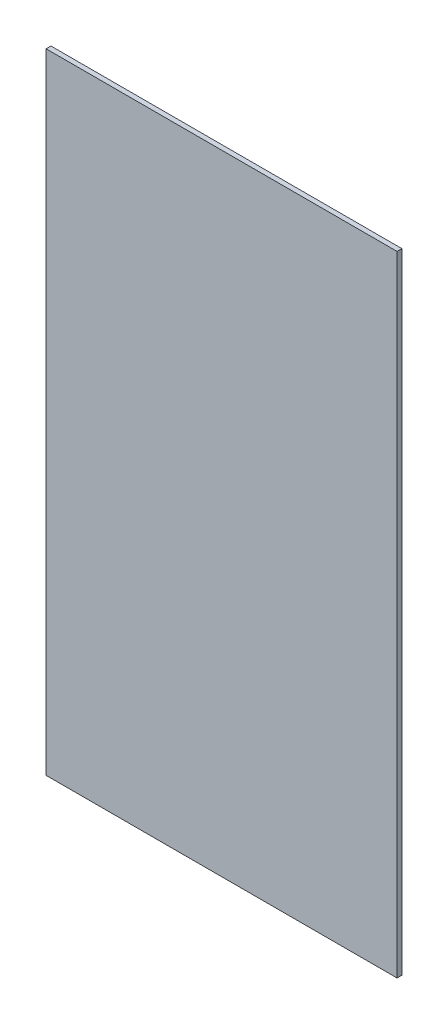
from build123d import *

# Parameters (mm, degrees)
SKETCH1_W           = 9.2075
SKETCH1_H           = 16.51
BOSS_EXTRUDE1_DEPTH = 0.127
WRAP1_START         = -0.0254
WRAP1_DEPTH         = 0.0254


# Read off the part's stored shape, not the designer's step: Wrap1
with BuildPart() as part:
    # Sketch1 → Boss-Extrude1 (new body)
    with BuildSketch(Plane.XY):
        with Locations((-14.669644351, 41.878696913)):
            Rectangle(SKETCH1_W, SKETCH1_H)
    extrude(amount=BOSS_EXTRUDE1_DEPTH)

    # Wrap1 outline → Wrap1 (cut)
    # profile 1 of 4: a face of its own
    with BuildSketch(Plane(origin=(0, 0, 0), x_dir=(-1, 0, 0), z_dir=(0, 0, -1)).offset(WRAP1_START)):
        with BuildLine():
            add(Edge.make_bspline(
                [(12.754195013, 35.369837928), (12.7302514, 35.363485984), (12.684730689, 35.351409901), (12.617465783, 35.344197722), (12.555782538, 35.346965505), (12.499458703, 35.359902044), (12.44943973, 35.384788998), (12.405542275, 35.419870428), (12.367751604, 35.465127753), (12.337830196, 35.518652718), (12.316076601, 35.575477835), (12.303665057, 35.631953818), (12.303965451, 35.686435762), (12.317272149, 35.737607038), (12.341374713, 35.78598946), (12.378118313, 35.830483531), (12.425460462, 35.872778478), (12.463142079, 35.89613621), (12.482992555, 35.90844094)],
                knots=[0, 0, 0, 0, 0.077726432, 0.147770616, 0.211548784, 0.270927228, 0.327895714, 0.385505761, 0.446243759, 0.511912564, 0.577218406, 0.636811441, 0.692545749, 0.746612378, 0.801503143, 0.860977879, 0.926763881, 1, 1, 1, 1], degree=3))
            Line((12.754195013, 35.369837928), (15.230501566, 36.625099771))
            Line((15.230501566, 36.625099771), (16.18224477, 35.63470388))
            add(Edge.make_bspline(
                [(16.618830035, 36.05608153), (16.632346442, 36.036387077), (16.657970773, 35.99905044), (16.684879163, 35.939908415), (16.701202291, 35.88261282), (16.704360316, 35.826437061), (16.696209976, 35.771841191), (16.675014413, 35.719604082), (16.642356284, 35.669326668), (16.599558818, 35.622991267), (16.551509997, 35.5826488), (16.500267548, 35.553138521), (16.448421639, 35.535072681), (16.395218592, 35.530880946), (16.341459507, 35.53783476), (16.287609709, 35.558503293), (16.233513601, 35.59108586), (16.200005781, 35.619593332), (16.18224477, 35.63470388)],
                knots=[0, 0, 0, 0, 0.075168859, 0.14250471, 0.203878623, 0.261899768, 0.318493707, 0.37648046, 0.438167773, 0.506513204, 0.574627985, 0.635161891, 0.692009835, 0.746141543, 0.801887068, 0.861502259, 0.926588482, 1, 1, 1, 1], degree=3))
            Line((16.618830035, 36.05608153), (15.106939699, 37.625634072))
            Line((15.106939699, 37.625634072), (16.396418674, 37.625634072))
            add(Edge.make_bspline(
                [(16.396418674, 38.228869445), (16.419739871, 38.226285995), (16.463954003, 38.22138809), (16.52570904, 38.205398766), (16.578162156, 38.180362601), (16.621817506, 38.147785143), (16.65561524, 38.106569203), (16.680074206, 38.057673788), (16.695079698, 38.001222704), (16.699870998, 37.939805513), (16.697679332, 37.878150965), (16.684326243, 37.820397698), (16.660842522, 37.769413814), (16.626638141, 37.725931096), (16.583448306, 37.688905899), (16.529416497, 37.660921883), (16.466608834, 37.638250255), (16.420678658, 37.629994632), (16.396418674, 37.625634072)],
                knots=[0, 0, 0, 0, 0.073642632, 0.139617403, 0.199251584, 0.255106185, 0.309293346, 0.365065168, 0.425571036, 0.491512451, 0.557929264, 0.618587659, 0.676454286, 0.732713138, 0.791064393, 0.853692913, 0.922721664, 1, 1, 1, 1], degree=3))
            Line((16.396418674, 38.228869445), (12.615425531, 38.228869445))
            add(Edge.make_bspline(
                [(12.615425531, 37.625634072), (12.59181657, 37.630050549), (12.546769776, 37.638477356), (12.485015211, 37.660685192), (12.43202381, 37.68932657), (12.388991975, 37.725714847), (12.355354595, 37.769481471), (12.332866668, 37.820634371), (12.318483946, 37.878048835), (12.315787423, 37.939783609), (12.320006756, 38.001130938), (12.334136705, 38.057797338), (12.358857207, 38.106352751), (12.391843084, 38.147761354), (12.435047012, 38.180537391), (12.487243395, 38.205244445), (12.548500877, 38.221425467), (12.592309604, 38.226298278), (12.615425531, 38.228869445)],
                knots=[0, 0, 0, 0, 0.075839881, 0.144705368, 0.206585145, 0.265329705, 0.321560784, 0.379537358, 0.440761422, 0.507662578, 0.573991332, 0.634732734, 0.690880475, 0.745010219, 0.800711387, 0.860747521, 0.926522625, 1, 1, 1, 1], degree=3))
            Line((12.615425531, 37.625634072), (14.268619952, 37.625634072))
            Line((14.268619952, 37.625634072), (14.794549952, 37.080694554))
            Line((14.794549952, 37.080694554), (12.482992555, 35.90844094))
        make_face()
    # profile 2 of 4: a face of its own
    with BuildSketch(Plane(origin=(0, 0, 0), x_dir=(-1, 0, 0), z_dir=(0, 0, -1)).offset(WRAP1_START)):
        with BuildLine():
            add(Edge.make_bspline(
                [(13.047575242, 39.153999324), (13.020565506, 39.170397438), (12.966704064, 39.203097725), (12.889276071, 39.257267095), (12.814727047, 39.315536302), (12.744302072, 39.37910097), (12.675801125, 39.445922965), (12.610595397, 39.517236285), (12.549482157, 39.593843689), (12.490249391, 39.672716183), (12.437718426, 39.755560493), (12.394528764, 39.841630583), (12.359777926, 39.929487791), (12.335032031, 40.019797717), (12.319870897, 40.112410175), (12.31352497, 40.207026903), (12.316396513, 40.303891545), (12.326032667, 40.368353467), (12.330916411, 40.401023709)],
                knots=[0, 0, 0, 0, 0.061850963, 0.123340048, 0.184890287, 0.246981332, 0.308975903, 0.372205026, 0.436014336, 0.500775998, 0.565257145, 0.627766796, 0.689048332, 0.749944952, 0.810723512, 0.872479012, 0.935370505, 1, 1, 1, 1], degree=3))
            add(Edge.make_bspline(
                [(15.440239915, 38.953132083), (15.390736365, 38.937681139), (15.291933808, 38.906843093), (15.141644573, 38.868807028), (14.989739533, 38.838977629), (14.836569089, 38.817150582), (14.682071565, 38.80139499), (14.525952955, 38.794773648), (14.368418204, 38.795333989), (14.210256211, 38.803669263), (14.053250399, 38.819052747), (13.899115301, 38.84338307), (13.748403962, 38.874865467), (13.601279506, 38.915053152), (13.457363794, 38.962431738), (13.316885067, 39.017812179), (13.17967544, 39.080728277), (13.091636172, 39.129560371), (13.047575242, 39.153999324)],
                knots=[0, 0, 0, 0, 0.062950861, 0.125641615, 0.188101714, 0.250802955, 0.313418143, 0.376562472, 0.440413566, 0.504607187, 0.568778782, 0.631848088, 0.693959276, 0.755605023, 0.816909022, 0.877812703, 0.938849039, 1, 1, 1, 1], degree=3))
            add(Edge.make_bspline(
                [(16.699937312, 40.319916432), (16.698715623, 40.276974445), (16.696320809, 40.192797527), (16.677610239, 40.069496857), (16.646475993, 39.952472543), (16.603397029, 39.840910653), (16.546155734, 39.736261976), (16.478243728, 39.636568797), (16.397162788, 39.543458512), (16.30353829, 39.458706035), (16.204179087, 39.378421994), (16.101175663, 39.303167786), (15.99677858, 39.232015443), (15.890081966, 39.165938588), (15.781025073, 39.104945851), (15.669314181, 39.049560246), (15.556227713, 38.997573399), (15.478853218, 38.967926967), (15.440239915, 38.953132083)],
                knots=[0, 0, 0, 0, 0.064865228, 0.127151896, 0.18792138, 0.247542801, 0.30737398, 0.367746614, 0.429503662, 0.493416613, 0.558312454, 0.622464006, 0.686108662, 0.74916729, 0.812031791, 0.87483145, 0.937535344, 1, 1, 1, 1], degree=3))
            add(Edge.make_bspline(
                [(16.554831324, 40.847747383), (16.577106188, 40.805811266), (16.62103266, 40.723112411), (16.666327282, 40.591198468), (16.695006674, 40.456554383), (16.698293465, 40.365470759), (16.699937312, 40.319916432)],
                knots=[0, 0, 0, 0, 0.257009808, 0.506828434, 0.753346452, 1, 1, 1, 1], degree=3))
            add(Edge.make_bspline(
                [(12.330916411, 40.401023709), (12.341658838, 40.453680213), (12.362823153, 40.557422016), (12.412817707, 40.706106683), (12.476374603, 40.845331452), (12.554156659, 40.974796833), (12.646186394, 41.094897018), (12.752396269, 41.205193981), (12.872502018, 41.306261554), (13.006235209, 41.395407843), (13.147982814, 41.47650703), (13.29497072, 41.548650844), (13.445846867, 41.611712386), (13.600589967, 41.665454463), (13.759374118, 41.710765472), (13.922163513, 41.746070379), (14.088915317, 41.772023594), (14.258578003, 41.788948689), (14.429886846, 41.797088379), (14.601023806, 41.796795808), (14.771017061, 41.786143501), (14.939901664, 41.768260492), (15.107364574, 41.74004135), (15.273806488, 41.703224529), (15.439182558, 41.657499186), (15.602119891, 41.603735104), (15.759207756, 41.541247608), (15.906688134, 41.468862266), (16.043354319, 41.388062532), (16.168333209, 41.29748971), (16.282087228, 41.198318153), (16.385513343, 41.090876698), (16.477427957, 40.974167414), (16.529022883, 40.889899346), (16.554831324, 40.847747383)],
                knots=[0, 0, 0, 0, 0.031147051, 0.061364714, 0.090747353, 0.119762221, 0.148773727, 0.17831962, 0.208404877, 0.239631333, 0.271404761, 0.303072678, 0.334538531, 0.366192464, 0.398030774, 0.430254239, 0.462742101, 0.495862476, 0.52910046, 0.562177985, 0.595068726, 0.627849083, 0.660637451, 0.69351176, 0.726680813, 0.760113967, 0.792986679, 0.824654596, 0.855308419, 0.884959528, 0.914047755, 0.942727571, 0.9713516, 1, 1, 1, 1], degree=3))
        make_face()
        with BuildLine():
            add(Edge.make_bspline(
                [(14.946626096, 41.153800624), (14.908460653, 41.159999561), (14.828434558, 41.172997621), (14.70179711, 41.183104008), (14.563709638, 41.186321639), (14.416344734, 41.184755833), (14.26355893, 41.175680605), (14.109827981, 41.156954823), (13.956830057, 41.130468576), (13.805670073, 41.095286227), (13.658477901, 41.051510683), (13.517509658, 40.99769277), (13.384563572, 40.932893211), (13.279795347, 40.871121168), (13.20148846, 40.81691271), (13.148978535, 40.771856291), (13.100019184, 40.725407946), (13.058024937, 40.674041412), (13.019293662, 40.62109498), (12.987304981, 40.563957251), (12.958686451, 40.504605081), (12.944891401, 40.462668039), (12.937953688, 40.441577347)],
                knots=[0, 0, 0, 0, 0.0507636, 0.106442172, 0.166659367, 0.232129305, 0.29994087, 0.367550155, 0.435409362, 0.503771861, 0.571258119, 0.636939855, 0.701700182, 0.765257596, 0.796504611, 0.826623111, 0.856047652, 0.884993671, 0.913628325, 0.942082369, 0.970872458, 1, 1, 1, 1], degree=3))
            add(Edge.make_bspline(
                [(16.092900035, 40.302807865), (16.091867113, 40.334822408), (16.089847307, 40.397424533), (16.068588765, 40.487798051), (16.035296622, 40.572253613), (15.988828113, 40.650881208), (15.927693721, 40.722554567), (15.854340859, 40.78875229), (15.767292078, 40.848538869), (15.668871567, 40.899565167), (15.56677686, 40.946090705), (15.467023683, 40.990031581), (15.370876886, 41.028921732), (15.278653779, 41.062873279), (15.190361404, 41.093267632), (15.105625843, 41.117576752), (15.024995293, 41.138375285), (14.972236913, 41.14875967), (14.946626096, 41.153800624)],
                knots=[0, 0, 0, 0, 0.062095975, 0.121424195, 0.179257833, 0.237948334, 0.29794679, 0.361569549, 0.429407377, 0.502470815, 0.5766401, 0.647385329, 0.71421039, 0.778085382, 0.838293943, 0.895559997, 0.949301063, 1, 1, 1, 1], degree=3))
            add(Edge.make_bspline(
                [(16.079593373, 40.204592022), (16.083546956, 40.219719072), (16.091957677, 40.251899855), (16.092573624, 40.285174471), (16.092900035, 40.302807865)],
                knots=[0, 0, 0, 0, 0.470064685, 1, 1, 1, 1], degree=3))
            add(Edge.make_bspline(
                [(13.509506531, 39.596921095), (13.530734351, 39.587578352), (13.574167231, 39.568462767), (13.643121034, 39.544049048), (13.716683902, 39.521233575), (13.795078366, 39.500377197), (13.878365185, 39.481951729), (13.966383976, 39.466463061), (14.05908477, 39.452297604), (14.188874979, 39.437274454), (14.354766149, 39.425838811), (14.554772281, 39.423441792), (14.754745702, 39.435387971), (14.953045271, 39.458684771), (15.146719387, 39.496454522), (15.332464216, 39.547645519), (15.507401148, 39.61584488), (15.645811103, 39.68260127), (15.748541585, 39.744586727), (15.817971247, 39.796084024), (15.880069456, 39.852218637), (15.934884848, 39.913366306), (15.982421815, 39.979251641), (16.022672486, 40.049778288), (16.056266869, 40.12476688), (16.071753681, 40.177763977), (16.079593373, 40.204592022)],
                knots=[0, 0, 0, 0, 0.024018651, 0.04914302, 0.075718465, 0.103794512, 0.133151769, 0.164053514, 0.196359525, 0.230284718, 0.299375844, 0.368520998, 0.437338222, 0.506761157, 0.575204827, 0.641567013, 0.70605332, 0.76946268, 0.800496605, 0.830210467, 0.858867098, 0.887068198, 0.915123776, 0.942860139, 0.971074817, 1, 1, 1, 1], degree=3))
            add(Edge.make_bspline(
                [(12.937953688, 40.441577347), (12.931277258, 40.417202641), (12.918291251, 40.369792555), (12.908434791, 40.298263751), (12.909060021, 40.229129247), (12.91920796, 40.16251528), (12.938968662, 40.098608083), (12.968779999, 40.037389997), (13.00843811, 39.979084651), (13.073062899, 39.905748717), (13.16254302, 39.823127873), (13.274711993, 39.73462149), (13.388896116, 39.657145973), (13.469739863, 39.616777943), (13.509506531, 39.596921095)],
                knots=[0, 0, 0, 0, 0.067561319, 0.13141032, 0.19243676, 0.251891804, 0.311048069, 0.370688085, 0.433373919, 0.499073713, 0.631781273, 0.758501722, 0.881208109, 1, 1, 1, 1], degree=3))
        make_face(mode=Mode.SUBTRACT)
    # profile 3 of 4: a face of its own
    with BuildSketch(Plane(origin=(0, 0, 0), x_dir=(-1, 0, 0), z_dir=(0, 0, -1)).offset(WRAP1_START)):
        with BuildLine():
            add(Edge.make_bspline(
                [(13.047575242, 42.722719515), (13.020565506, 42.739117629), (12.966704064, 42.771817916), (12.889276071, 42.825987286), (12.814727047, 42.884256493), (12.744302072, 42.947821161), (12.675801125, 43.014643155), (12.610595397, 43.085956475), (12.549482157, 43.16256388), (12.490249391, 43.241436374), (12.437718426, 43.324280684), (12.394528764, 43.410350774), (12.359777926, 43.498207981), (12.335032031, 43.588517908), (12.319870897, 43.681130366), (12.31352497, 43.775747094), (12.316396513, 43.872611736), (12.326032667, 43.937073658), (12.330916411, 43.969743899)],
                knots=[0, 0, 0, 0, 0.061850963, 0.123340048, 0.184890287, 0.246981332, 0.308975903, 0.372205026, 0.436014336, 0.500775998, 0.565257145, 0.627766796, 0.689048332, 0.749944952, 0.810723512, 0.872479012, 0.935370505, 1, 1, 1, 1], degree=3))
            add(Edge.make_bspline(
                [(15.440239915, 42.521852274), (15.390736365, 42.50640133), (15.291933808, 42.475563284), (15.141644573, 42.437527219), (14.989739533, 42.40769782), (14.836569089, 42.385870773), (14.682071565, 42.370115181), (14.525952955, 42.363493839), (14.368418204, 42.36405418), (14.210256211, 42.372389454), (14.053250399, 42.387772938), (13.899115301, 42.412103261), (13.748403962, 42.443585658), (13.601279506, 42.483773343), (13.457363794, 42.531151929), (13.316885067, 42.58653237), (13.17967544, 42.649448467), (13.091636172, 42.698280562), (13.047575242, 42.722719515)],
                knots=[0, 0, 0, 0, 0.062950861, 0.125641615, 0.188101714, 0.250802955, 0.313418143, 0.376562472, 0.440413566, 0.504607187, 0.568778782, 0.631848088, 0.693959276, 0.755605023, 0.816909022, 0.877812703, 0.938849039, 1, 1, 1, 1], degree=3))
            add(Edge.make_bspline(
                [(16.699937312, 43.888636622), (16.698715623, 43.845694636), (16.696320809, 43.761517718), (16.677610239, 43.638217048), (16.646475993, 43.521192733), (16.603397029, 43.409630844), (16.546155734, 43.304982167), (16.478243728, 43.205288987), (16.397162788, 43.112178703), (16.30353829, 43.027426226), (16.204179087, 42.947142185), (16.101175663, 42.871887976), (15.99677858, 42.800735634), (15.890081966, 42.734658779), (15.781025073, 42.673666042), (15.669314181, 42.618280436), (15.556227713, 42.56629359), (15.478853218, 42.536647158), (15.440239915, 42.521852274)],
                knots=[0, 0, 0, 0, 0.064865228, 0.127151896, 0.18792138, 0.247542801, 0.30737398, 0.367746614, 0.429503662, 0.493416613, 0.558312454, 0.622464006, 0.686108662, 0.74916729, 0.812031791, 0.87483145, 0.937535344, 1, 1, 1, 1], degree=3))
            add(Edge.make_bspline(
                [(16.554831324, 44.416467574), (16.577106188, 44.374531456), (16.62103266, 44.291832602), (16.666327282, 44.159918658), (16.695006674, 44.025274574), (16.698293465, 43.93419095), (16.699937312, 43.888636622)],
                knots=[0, 0, 0, 0, 0.257009808, 0.506828434, 0.753346452, 1, 1, 1, 1], degree=3))
            add(Edge.make_bspline(
                [(12.330916411, 43.969743899), (12.341658838, 44.022400403), (12.362823153, 44.126142207), (12.412817707, 44.274826874), (12.476374603, 44.414051643), (12.554156659, 44.543517024), (12.646186394, 44.663617208), (12.752396269, 44.773914172), (12.872502018, 44.874981745), (13.006235209, 44.964128034), (13.147982814, 45.04522722), (13.29497072, 45.117371035), (13.445846867, 45.180432577), (13.600589967, 45.234174654), (13.759374118, 45.279485663), (13.922163513, 45.31479057), (14.088915317, 45.340743784), (14.258578003, 45.35766888), (14.429886846, 45.36580857), (14.601023806, 45.365515999), (14.771017061, 45.354863691), (14.939901664, 45.336980683), (15.107364574, 45.308761541), (15.273806488, 45.27194472), (15.439182558, 45.226219377), (15.602119891, 45.172455295), (15.759207756, 45.109967799), (15.906688134, 45.037582457), (16.043354319, 44.956782723), (16.168333209, 44.8662099), (16.282087228, 44.767038344), (16.385513343, 44.659596889), (16.477427957, 44.542887605), (16.529022883, 44.458619537), (16.554831324, 44.416467574)],
                knots=[0, 0, 0, 0, 0.031147051, 0.061364714, 0.090747353, 0.119762221, 0.148773727, 0.17831962, 0.208404877, 0.239631333, 0.271404761, 0.303072678, 0.334538531, 0.366192464, 0.398030774, 0.430254239, 0.462742101, 0.495862476, 0.52910046, 0.562177985, 0.595068726, 0.627849083, 0.660637451, 0.69351176, 0.726680813, 0.760113967, 0.792986679, 0.824654596, 0.855308419, 0.884959528, 0.914047755, 0.942727571, 0.9713516, 1, 1, 1, 1], degree=3))
        make_face()
        with BuildLine():
            add(Edge.make_bspline(
                [(14.946626096, 44.722520815), (14.908460653, 44.728719752), (14.828434558, 44.741717812), (14.70179711, 44.751824199), (14.563709638, 44.75504183), (14.416344734, 44.753476023), (14.26355893, 44.744400796), (14.109827981, 44.725675014), (13.956830057, 44.699188767), (13.805670073, 44.664006418), (13.658477901, 44.620230874), (13.517509658, 44.566412961), (13.384563572, 44.501613402), (13.279795347, 44.439841359), (13.20148846, 44.385632901), (13.148978535, 44.340576482), (13.100019184, 44.294128136), (13.058024937, 44.242761603), (13.019293662, 44.189815171), (12.987304981, 44.132677441), (12.958686451, 44.073325272), (12.944891401, 44.03138823), (12.937953688, 44.010297538)],
                knots=[0, 0, 0, 0, 0.0507636, 0.106442172, 0.166659367, 0.232129305, 0.29994087, 0.367550155, 0.435409362, 0.503771861, 0.571258119, 0.636939855, 0.701700182, 0.765257596, 0.796504611, 0.826623111, 0.856047652, 0.884993671, 0.913628325, 0.942082369, 0.970872458, 1, 1, 1, 1], degree=3))
            add(Edge.make_bspline(
                [(16.092900035, 43.871528056), (16.091867113, 43.903542599), (16.089847307, 43.966144724), (16.068588765, 44.056518242), (16.035296622, 44.140973804), (15.988828113, 44.219601399), (15.927693721, 44.291274758), (15.854340859, 44.357472481), (15.767292078, 44.417259059), (15.668871567, 44.468285358), (15.56677686, 44.514810895), (15.467023683, 44.558751771), (15.370876886, 44.597641923), (15.278653779, 44.63159347), (15.190361404, 44.661987823), (15.105625843, 44.686296943), (15.024995293, 44.707095476), (14.972236913, 44.717479861), (14.946626096, 44.722520815)],
                knots=[0, 0, 0, 0, 0.062095975, 0.121424195, 0.179257833, 0.237948334, 0.29794679, 0.361569549, 0.429407377, 0.502470815, 0.5766401, 0.647385329, 0.71421039, 0.778085382, 0.838293943, 0.895559997, 0.949301063, 1, 1, 1, 1], degree=3))
            add(Edge.make_bspline(
                [(16.079593373, 43.773312213), (16.083546956, 43.788439263), (16.091957677, 43.820620046), (16.092573624, 43.853894662), (16.092900035, 43.871528056)],
                knots=[0, 0, 0, 0, 0.470064685, 1, 1, 1, 1], degree=3))
            add(Edge.make_bspline(
                [(13.509506531, 43.165641285), (13.530734351, 43.156298543), (13.574167231, 43.137182958), (13.643121034, 43.112769239), (13.716683902, 43.089953766), (13.795078366, 43.069097388), (13.878365185, 43.05067192), (13.966383976, 43.035183251), (14.05908477, 43.021017795), (14.188874979, 43.005994645), (14.354766149, 42.994559002), (14.554772281, 42.992161983), (14.754745702, 43.004108162), (14.953045271, 43.027404962), (15.146719387, 43.065174713), (15.332464216, 43.11636571), (15.507401148, 43.184565071), (15.645811103, 43.251321461), (15.748541585, 43.313306918), (15.817971247, 43.364804214), (15.880069456, 43.420938828), (15.934884848, 43.482086497), (15.982421815, 43.547971832), (16.022672486, 43.618498479), (16.056266869, 43.69348707), (16.071753681, 43.746484168), (16.079593373, 43.773312213)],
                knots=[0, 0, 0, 0, 0.024018651, 0.04914302, 0.075718465, 0.103794512, 0.133151769, 0.164053514, 0.196359525, 0.230284718, 0.299375844, 0.368520998, 0.437338222, 0.506761157, 0.575204827, 0.641567013, 0.70605332, 0.76946268, 0.800496605, 0.830210467, 0.858867098, 0.887068198, 0.915123776, 0.942860139, 0.971074817, 1, 1, 1, 1], degree=3))
            add(Edge.make_bspline(
                [(12.937953688, 44.010297538), (12.931277258, 43.985922832), (12.918291251, 43.938512745), (12.908434791, 43.866983942), (12.909060021, 43.797849437), (12.91920796, 43.731235471), (12.938968662, 43.667328274), (12.968779999, 43.606110187), (13.00843811, 43.547804842), (13.073062899, 43.474468908), (13.16254302, 43.391848064), (13.274711993, 43.303341681), (13.388896116, 43.225866164), (13.469739863, 43.185498134), (13.509506531, 43.165641285)],
                knots=[0, 0, 0, 0, 0.067561319, 0.13141032, 0.19243676, 0.251891804, 0.311048069, 0.370688085, 0.433373919, 0.499073713, 0.631781273, 0.758501722, 0.881208109, 1, 1, 1, 1], degree=3))
        make_face(mode=Mode.SUBTRACT)
    # profile 4 of 4: a face of its own
    with BuildSketch(Plane(origin=(0, 0, 0), x_dir=(-1, 0, 0), z_dir=(0, 0, -1)).offset(WRAP1_START)):
        with BuildLine():
            add(Edge.make_bspline(
                [(16.396418674, 48.894476379), (16.420648831, 48.890283436), (16.466490926, 48.882350623), (16.52977657, 48.860774992), (16.583018861, 48.83162339), (16.626884546, 48.795534107), (16.660610916, 48.752031081), (16.684487498, 48.701489978), (16.697642817, 48.643841655), (16.699884021, 48.582208835), (16.695066151, 48.520795996), (16.680111307, 48.464309704), (16.655417602, 48.41539058), (16.622050159, 48.37362768), (16.578156527, 48.340950149), (16.525508095, 48.316300073), (16.464192248, 48.298285988), (16.419782791, 48.293669678), (16.396418674, 48.291241006)],
                knots=[0, 0, 0, 0, 0.077159118, 0.145980716, 0.208940101, 0.266874772, 0.323144349, 0.380421865, 0.441091824, 0.507521297, 0.573475283, 0.633992686, 0.689775139, 0.74448594, 0.800351189, 0.859996738, 0.92634333, 1, 1, 1, 1], degree=3))
            Line((16.396418674, 48.894476379), (12.615425531, 48.894476379))
            add(Edge.make_bspline(
                [(12.615425531, 48.291241006), (12.592264977, 48.293656581), (12.548256587, 48.298246522), (12.487460628, 48.316468602), (12.43500972, 48.340739291), (12.39165054, 48.373857969), (12.358360973, 48.415376273), (12.333451554, 48.464216251), (12.319600879, 48.520907756), (12.314191627, 48.582218827), (12.317606793, 48.643812887), (12.330428797, 48.70152443), (12.354503363, 48.751799892), (12.387423468, 48.795755592), (12.431304428, 48.831399218), (12.48390517, 48.860823657), (12.546425854, 48.882255762), (12.591624118, 48.890260881), (12.615425531, 48.894476379)],
                knots=[0, 0, 0, 0, 0.073356275, 0.139387493, 0.19932468, 0.254934046, 0.309912357, 0.36596756, 0.426608852, 0.492885321, 0.559676216, 0.620642822, 0.678200398, 0.734338802, 0.792556745, 0.855241664, 0.923770237, 1, 1, 1, 1], degree=3))
            Line((12.615425531, 48.291241006), (14.375073253, 48.291241006))
            Line((14.375073253, 48.291241006), (14.375073253, 46.56961232))
            Line((14.375073253, 46.56961232), (12.615425531, 46.56961232))
            add(Edge.make_bspline(
                [(12.615425531, 45.962575043), (12.591604324, 45.966989989), (12.546603013, 45.975330389), (12.484773395, 45.997274913), (12.431726913, 46.024804801), (12.388413067, 46.060227779), (12.354365892, 46.102365918), (12.330749791, 46.15163719), (12.316900442, 46.207202028), (12.312947965, 46.266982821), (12.317717889, 46.32659843), (12.331030187, 46.382505327), (12.355948018, 46.43105452), (12.389580383, 46.473044634), (12.432433294, 46.508810149), (12.485312569, 46.536267015), (12.547110208, 46.55733664), (12.591832027, 46.565372769), (12.615425531, 46.56961232)],
                knots=[0, 0, 0, 0, 0.07655663, 0.144625282, 0.206823055, 0.264759453, 0.320394847, 0.376890758, 0.436221393, 0.500555104, 0.565606956, 0.624937591, 0.68113223, 0.736767624, 0.794188987, 0.856386761, 0.924235204, 1, 1, 1, 1], degree=3))
            Line((12.615425531, 45.962575043), (16.396418674, 45.962575043))
            add(Edge.make_bspline(
                [(16.396418674, 46.56961232), (16.420224307, 46.565388214), (16.465165615, 46.557413764), (16.527197162, 46.536302021), (16.580081024, 46.508602872), (16.623511258, 46.473272933), (16.65714157, 46.431027803), (16.682087563, 46.382512947), (16.695391733, 46.326596092), (16.700164007, 46.266983561), (16.696211141, 46.207201508), (16.682361062, 46.151638448), (16.658748014, 46.102361612), (16.624689436, 46.060243848), (16.581275701, 46.024620952), (16.527661479, 45.997304523), (16.465425333, 45.975419707), (16.420235736, 45.96700827), (16.396418674, 45.962575043)],
                knots=[0, 0, 0, 0, 0.076237195, 0.143923885, 0.205973376, 0.263771651, 0.319274409, 0.375335077, 0.434524265, 0.49942103, 0.563601367, 0.622790556, 0.679151777, 0.734654535, 0.792452809, 0.855090629, 0.923625884, 1, 1, 1, 1], degree=3))
            Line((16.396418674, 46.56961232), (14.982744181, 46.56961232))
            Line((14.982744181, 46.56961232), (14.982744181, 48.291241006))
            Line((14.982744181, 48.291241006), (16.396418674, 48.291241006))
        make_face()
    extrude(amount=WRAP1_DEPTH, mode=Mode.SUBTRACT)


solid = part.part
